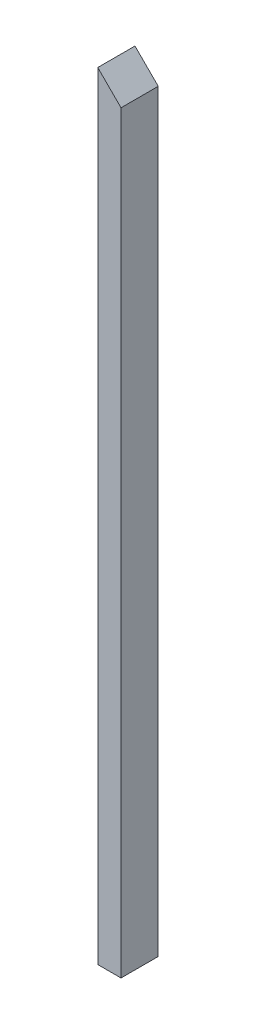
from build123d import *

# Parameters (mm, degrees)
BOSS_EXTRUDE1_DEPTH = 101.6


with BuildPart() as part:
    # Sketch1 → Boss-Extrude1 (new body)
    with BuildSketch(Plane.XY):
        Polygon((0, 0), (0, 2120.9), (63.5, 2057.4), (63.5, 0), align=None)
    extrude(amount=BOSS_EXTRUDE1_DEPTH)


solid = part.part
